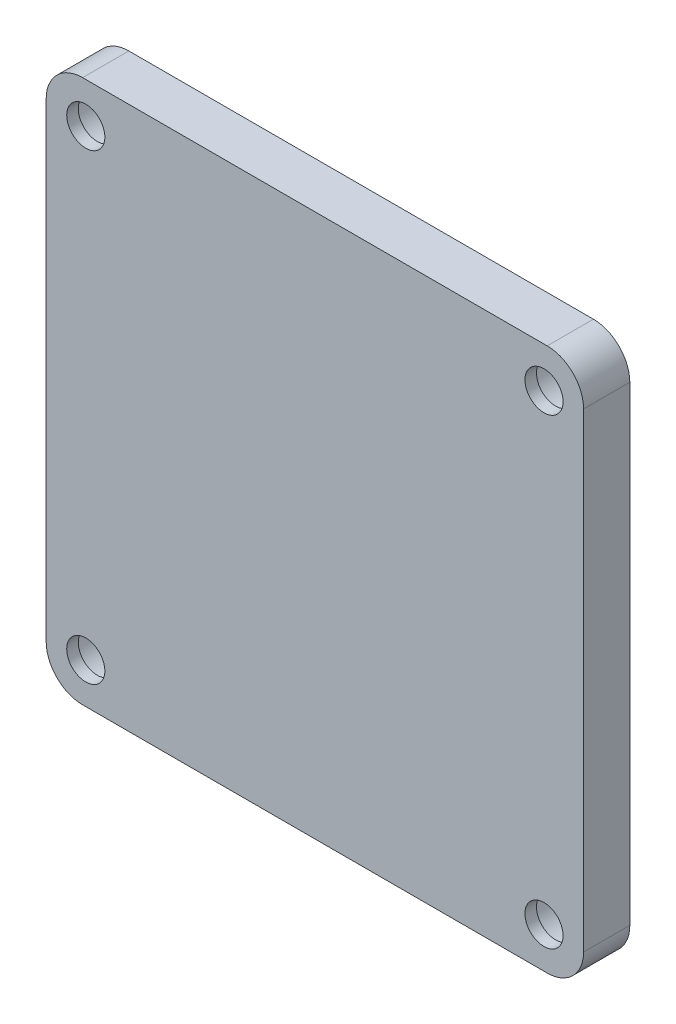
from build123d import *

# Parameters (mm, degrees)
ESQUISSE1_W                                        = 93
ESQUISSE1_H                                        = 94
EXTRUSION1_DEPTH                                   = 8
CONG_1_R                                           = 6.3
CHAMBRAGE_POUR_VIS_T_TE_HEXAGONALE_M61_D           = 6.6
CHAMBRAGE_POUR_VIS_T_TE_HEXAGONALE_M61_CBORE_D     = 11
CHAMBRAGE_POUR_VIS_T_TE_HEXAGONALE_M61_CBORE_DEPTH = 6
ESQUISSE10_W                                       = 40
ESQUISSE10_H                                       = 25
ENL_V_MAT_EXTRU_1_DEPTH                            = 2
CONG_2_R                                           = 2


with BuildPart() as part:
    # Esquisse1 → Extrusion1 (new body)
    with BuildSketch(Plane.XY):
        Rectangle(ESQUISSE1_W, ESQUISSE1_H)
    extrude(amount=EXTRUSION1_DEPTH)

    # Congé1
    cong_1_edges = [part.edges().sort_by_distance(p)[0] for p in [
        (-46.5, 47, 4),
        (46.5, 47, 4),
        (46.5, -47, 4),
        (-46.5, -47, 4),
    ]]
    fillet(cong_1_edges, radius=CONG_1_R)

    # Chambrage pour vis à tête hexagonale M61 (through all)
    with Locations(Plane(origin=(0, 0, 0), x_dir=(-1, 0, 0), z_dir=(0, 0, -1))):
        with Locations((39.65, -40), (39.65, 40), (-39.65, 40), (-39.65, -40)):
            CounterBoreHole(CHAMBRAGE_POUR_VIS_T_TE_HEXAGONALE_M61_D / 2, CHAMBRAGE_POUR_VIS_T_TE_HEXAGONALE_M61_CBORE_D / 2, CHAMBRAGE_POUR_VIS_T_TE_HEXAGONALE_M61_CBORE_DEPTH)

    # Esquisse10 → Enlèv. mat.-Extru.1 (cut)
    with BuildSketch(Plane(origin=(0, 0, 0), x_dir=(-1, 0, 0), z_dir=(0, 0, -1))):
        with Locations((0, 22.804576525)):
            Rectangle(ESQUISSE10_W, ESQUISSE10_H)
    extrude(amount=-ENL_V_MAT_EXTRU_1_DEPTH, mode=Mode.SUBTRACT)

    # Congé2
    cong_2_edges = [part.edges().sort_by_distance(p)[0] for p in [
        (0, 35.304576525, 2),
        (-20, 22.804576525, 2),
        (0, 10.304576525, 2),
        (20, 22.804576525, 2),
    ]]
    fillet(cong_2_edges, radius=CONG_2_R - 0.0001)  # a hair under: the kernel refuses the full size


solid = part.part
